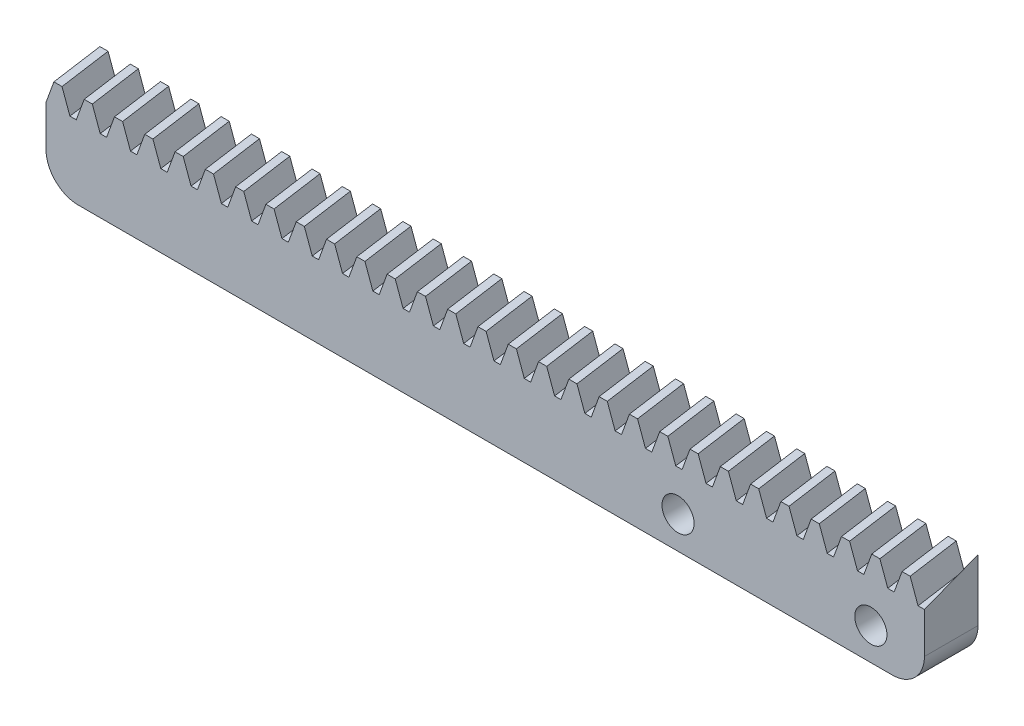
from build123d import *

# Parameters (mm, degrees)
SKETCH1_W           = 81.995568259
SKETCH1_H           = 8
EXTRUDE1_DEPTH      = 5
SKETCH_1_W          = 5
SKETCH_1_H          = 10
CUT_EXTRUDE_1_DEPTH = 85.754897932
SKETCH_2_W          = 81.995568259
SKETCH_2_H          = 5
CUT_EXTRUDE_2_DEPTH = 1.2
SKETCH_3_R          = 1.5
CUT_EXTRUDE_3_DEPTH = 83.428837386
FILLET_1_R          = 3


with BuildPart() as part:
    # Sketch1 → Extrude1 (new body)
    with BuildSketch(Plane.XY):
        with Locations((40.99778413, -4)):
            Rectangle(SKETCH1_W, SKETCH1_H)
    extrude(amount=EXTRUDE1_DEPTH)

    # 扫描1: read off the stored shape, not the designer's step
    # 扫描1: loft between two sections, ruled curve by curve
    sweep_1_from = [
        Edge.make_line((1.495609997, 2.025, 5), (0.792905823, 2.025, 0)),
        Edge.make_line((0.034335551, 2.025, 0), (0.737039724, 2.025, 5)),
        Edge.make_line((0.034335551, 2.025, 0), (0.792905823, 2.025, 0)),
        Edge.make_line((0.737039724, 2.025, 5), (1.495609997, 2.025, 5)),
    ]
    sweep_1_to = [
        Edge.make_line((2.232649721, 0, 5), (1.529945548, 0, 0)),
        Edge.make_line((-0.702704174, 0, 0), (0, 0, 5)),
        Edge.make_line((-0.702704174, 0, 0), (1.529945548, 0, 0)),
        Edge.make_line((0, 0, 5), (2.232649721, 0, 5)),
    ]
    sweep_1 = Solid(Shell([*[Face.make_surface_from_curves(sweep_1_from[k], sweep_1_to[k]) for k in range(4)], Face(Wire(sweep_1_from)), Face(Wire(sweep_1_to))]))
    add(sweep_1)

    # 阵列(线性)1: read off the stored shape, not the designer's step
    # 阵列(线性)1: loft between two sections, ruled curve by curve
    pattern_linear_1_from = [
        Edge.make_line((83.491178256, 2.025, 5), (82.732607983, 2.025, 5)),
        Edge.make_line((83.491178256, 2.025, 5), (82.788474082, 2.025, 0)),
        Edge.make_line((82.02990381, 2.025, 0), (82.732607983, 2.025, 5)),
        Edge.make_line((82.02990381, 2.025, 0), (82.788474082, 2.025, 0)),
    ]
    pattern_linear_1_to = [
        Edge.make_line((84.22821798, 0, 5), (81.995568259, 0, 5)),
        Edge.make_line((84.22821798, 0, 5), (83.525513806, 0, 0)),
        Edge.make_line((81.292864085, 0, 0), (81.995568259, 0, 5)),
        Edge.make_line((81.292864085, 0, 0), (83.525513806, 0, 0)),
    ]
    pattern_linear_1 = Solid(Shell([*[Face.make_surface_from_curves(pattern_linear_1_from[k], pattern_linear_1_to[k]) for k in range(4)], Face(Wire(pattern_linear_1_from)), Face(Wire(pattern_linear_1_to))]))
    add(pattern_linear_1)

    # Pattern Linear 1 2: loft between two sections, ruled curve by curve
    pattern_linear_1_2_from = [
        Edge.make_line((4.323043385, 2.025, 5), (3.620339212, 2.025, 0)),
        Edge.make_line((2.861768939, 2.025, 0), (3.564473113, 2.025, 5)),
        Edge.make_line((3.564473113, 2.025, 5), (4.323043385, 2.025, 5)),
        Edge.make_line((2.861768939, 2.025, 0), (3.620339212, 2.025, 0)),
    ]
    pattern_linear_1_2_to = [
        Edge.make_line((5.060083109, 0, 5), (4.357378936, 0, 0)),
        Edge.make_line((2.124729215, 0, 0), (2.827433388, 0, 5)),
        Edge.make_line((2.827433388, 0, 5), (5.060083109, 0, 5)),
        Edge.make_line((2.124729215, 0, 0), (4.357378936, 0, 0)),
    ]
    pattern_linear_1_2 = Solid(Shell([*[Face.make_surface_from_curves(pattern_linear_1_2_from[k], pattern_linear_1_2_to[k]) for k in range(4)], Face(Wire(pattern_linear_1_2_from)), Face(Wire(pattern_linear_1_2_to))]))
    add(pattern_linear_1_2)

    # Pattern Linear 1 3: loft between two sections, ruled curve by curve
    pattern_linear_1_3_from = [
        Edge.make_line((7.150476773, 2.025, 5), (6.4477726, 2.025, 0)),
        Edge.make_line((5.689202327, 2.025, 0), (6.391906501, 2.025, 5)),
        Edge.make_line((6.391906501, 2.025, 5), (7.150476773, 2.025, 5)),
        Edge.make_line((5.689202327, 2.025, 0), (6.4477726, 2.025, 0)),
    ]
    pattern_linear_1_3_to = [
        Edge.make_line((7.887516498, 0, 5), (7.184812324, 0, 0)),
        Edge.make_line((4.952162603, 0, 0), (5.654866776, 0, 5)),
        Edge.make_line((5.654866776, 0, 5), (7.887516498, 0, 5)),
        Edge.make_line((4.952162603, 0, 0), (7.184812324, 0, 0)),
    ]
    pattern_linear_1_3 = Solid(Shell([*[Face.make_surface_from_curves(pattern_linear_1_3_from[k], pattern_linear_1_3_to[k]) for k in range(4)], Face(Wire(pattern_linear_1_3_from)), Face(Wire(pattern_linear_1_3_to))]))
    add(pattern_linear_1_3)

    # Pattern Linear 1 4: loft between two sections, ruled curve by curve
    pattern_linear_1_4_from = [
        Edge.make_line((9.977910162, 2.025, 5), (9.275205988, 2.025, 0)),
        Edge.make_line((8.516635716, 2.025, 0), (9.219339889, 2.025, 5)),
        Edge.make_line((8.516635716, 2.025, 0), (9.275205988, 2.025, 0)),
        Edge.make_line((9.219339889, 2.025, 5), (9.977910162, 2.025, 5)),
    ]
    pattern_linear_1_4_to = [
        Edge.make_line((10.714949886, 0, 5), (10.012245712, 0, 0)),
        Edge.make_line((7.779595991, 0, 0), (8.482300165, 0, 5)),
        Edge.make_line((7.779595991, 0, 0), (10.012245712, 0, 0)),
        Edge.make_line((8.482300165, 0, 5), (10.714949886, 0, 5)),
    ]
    pattern_linear_1_4 = Solid(Shell([*[Face.make_surface_from_curves(pattern_linear_1_4_from[k], pattern_linear_1_4_to[k]) for k in range(4)], Face(Wire(pattern_linear_1_4_from)), Face(Wire(pattern_linear_1_4_to))]))
    add(pattern_linear_1_4)

    # Pattern Linear 1 5: loft between two sections, ruled curve by curve
    pattern_linear_1_5_from = [
        Edge.make_line((12.80534355, 2.025, 5), (12.102639376, 2.025, 0)),
        Edge.make_line((11.344069104, 2.025, 0), (12.046773277, 2.025, 5)),
        Edge.make_line((11.344069104, 2.025, 0), (12.102639376, 2.025, 0)),
        Edge.make_line((12.046773277, 2.025, 5), (12.80534355, 2.025, 5)),
    ]
    pattern_linear_1_5_to = [
        Edge.make_line((13.542383274, 0, 5), (12.839679101, 0, 0)),
        Edge.make_line((10.607029379, 0, 0), (11.309733553, 0, 5)),
        Edge.make_line((10.607029379, 0, 0), (12.839679101, 0, 0)),
        Edge.make_line((11.309733553, 0, 5), (13.542383274, 0, 5)),
    ]
    pattern_linear_1_5 = Solid(Shell([*[Face.make_surface_from_curves(pattern_linear_1_5_from[k], pattern_linear_1_5_to[k]) for k in range(4)], Face(Wire(pattern_linear_1_5_from)), Face(Wire(pattern_linear_1_5_to))]))
    add(pattern_linear_1_5)

    # Pattern Linear 1 6: loft between two sections, ruled curve by curve
    pattern_linear_1_6_from = [
        Edge.make_line((15.632776938, 2.025, 5), (14.930072764, 2.025, 0)),
        Edge.make_line((14.171502492, 2.025, 0), (14.874206666, 2.025, 5)),
        Edge.make_line((14.171502492, 2.025, 0), (14.930072764, 2.025, 0)),
        Edge.make_line((14.874206666, 2.025, 5), (15.632776938, 2.025, 5)),
    ]
    pattern_linear_1_6_to = [
        Edge.make_line((16.369816662, 0, 5), (15.667112489, 0, 0)),
        Edge.make_line((13.434462768, 0, 0), (14.137166941, 0, 5)),
        Edge.make_line((13.434462768, 0, 0), (15.667112489, 0, 0)),
        Edge.make_line((14.137166941, 0, 5), (16.369816662, 0, 5)),
    ]
    pattern_linear_1_6 = Solid(Shell([*[Face.make_surface_from_curves(pattern_linear_1_6_from[k], pattern_linear_1_6_to[k]) for k in range(4)], Face(Wire(pattern_linear_1_6_from)), Face(Wire(pattern_linear_1_6_to))]))
    add(pattern_linear_1_6)

    # Pattern Linear 1 7: loft between two sections, ruled curve by curve
    pattern_linear_1_7_from = [
        Edge.make_line((18.460210326, 2.025, 5), (17.757506153, 2.025, 0)),
        Edge.make_line((16.99893588, 2.025, 0), (17.701640054, 2.025, 5)),
        Edge.make_line((17.701640054, 2.025, 5), (18.460210326, 2.025, 5)),
        Edge.make_line((16.99893588, 2.025, 0), (17.757506153, 2.025, 0)),
    ]
    pattern_linear_1_7_to = [
        Edge.make_line((19.197250051, 0, 5), (18.494545877, 0, 0)),
        Edge.make_line((16.261896156, 0, 0), (16.964600329, 0, 5)),
        Edge.make_line((16.964600329, 0, 5), (19.197250051, 0, 5)),
        Edge.make_line((16.261896156, 0, 0), (18.494545877, 0, 0)),
    ]
    pattern_linear_1_7 = Solid(Shell([*[Face.make_surface_from_curves(pattern_linear_1_7_from[k], pattern_linear_1_7_to[k]) for k in range(4)], Face(Wire(pattern_linear_1_7_from)), Face(Wire(pattern_linear_1_7_to))]))
    add(pattern_linear_1_7)

    # Pattern Linear 1 8: loft between two sections, ruled curve by curve
    pattern_linear_1_8_from = [
        Edge.make_line((21.287643714, 2.025, 5), (20.584939541, 2.025, 0)),
        Edge.make_line((19.826369268, 2.025, 0), (20.529073442, 2.025, 5)),
        Edge.make_line((20.529073442, 2.025, 5), (21.287643714, 2.025, 5)),
        Edge.make_line((19.826369268, 2.025, 0), (20.584939541, 2.025, 0)),
    ]
    pattern_linear_1_8_to = [
        Edge.make_line((22.024683439, 0, 5), (21.321979265, 0, 0)),
        Edge.make_line((19.089329544, 0, 0), (19.792033718, 0, 5)),
        Edge.make_line((19.792033718, 0, 5), (22.024683439, 0, 5)),
        Edge.make_line((19.089329544, 0, 0), (21.321979265, 0, 0)),
    ]
    pattern_linear_1_8 = Solid(Shell([*[Face.make_surface_from_curves(pattern_linear_1_8_from[k], pattern_linear_1_8_to[k]) for k in range(4)], Face(Wire(pattern_linear_1_8_from)), Face(Wire(pattern_linear_1_8_to))]))
    add(pattern_linear_1_8)

    # Pattern Linear 1 9: loft between two sections, ruled curve by curve
    pattern_linear_1_9_from = [
        Edge.make_line((24.115077103, 2.025, 5), (23.412372929, 2.025, 0)),
        Edge.make_line((22.653802657, 2.025, 0), (23.35650683, 2.025, 5)),
        Edge.make_line((22.653802657, 2.025, 0), (23.412372929, 2.025, 0)),
        Edge.make_line((23.35650683, 2.025, 5), (24.115077103, 2.025, 5)),
    ]
    pattern_linear_1_9_to = [
        Edge.make_line((24.852116827, 0, 5), (24.149412654, 0, 0)),
        Edge.make_line((21.916762932, 0, 0), (22.619467106, 0, 5)),
        Edge.make_line((21.916762932, 0, 0), (24.149412654, 0, 0)),
        Edge.make_line((22.619467106, 0, 5), (24.852116827, 0, 5)),
    ]
    pattern_linear_1_9 = Solid(Shell([*[Face.make_surface_from_curves(pattern_linear_1_9_from[k], pattern_linear_1_9_to[k]) for k in range(4)], Face(Wire(pattern_linear_1_9_from)), Face(Wire(pattern_linear_1_9_to))]))
    add(pattern_linear_1_9)

    # Pattern Linear 1 10: loft between two sections, ruled curve by curve
    pattern_linear_1_10_from = [
        Edge.make_line((26.942510491, 2.025, 5), (26.239806317, 2.025, 0)),
        Edge.make_line((25.481236045, 2.025, 0), (26.183940218, 2.025, 5)),
        Edge.make_line((25.481236045, 2.025, 0), (26.239806317, 2.025, 0)),
        Edge.make_line((26.183940218, 2.025, 5), (26.942510491, 2.025, 5)),
    ]
    pattern_linear_1_10_to = [
        Edge.make_line((27.679550215, 0, 5), (26.976846042, 0, 0)),
        Edge.make_line((24.744196321, 0, 0), (25.446900494, 0, 5)),
        Edge.make_line((24.744196321, 0, 0), (26.976846042, 0, 0)),
        Edge.make_line((25.446900494, 0, 5), (27.679550215, 0, 5)),
    ]
    pattern_linear_1_10 = Solid(Shell([*[Face.make_surface_from_curves(pattern_linear_1_10_from[k], pattern_linear_1_10_to[k]) for k in range(4)], Face(Wire(pattern_linear_1_10_from)), Face(Wire(pattern_linear_1_10_to))]))
    add(pattern_linear_1_10)

    # Pattern Linear 1 11: loft between two sections, ruled curve by curve
    pattern_linear_1_11_from = [
        Edge.make_line((29.769943879, 2.025, 5), (29.067239706, 2.025, 0)),
        Edge.make_line((28.308669433, 2.025, 0), (29.011373607, 2.025, 5)),
        Edge.make_line((29.011373607, 2.025, 5), (29.769943879, 2.025, 5)),
        Edge.make_line((28.308669433, 2.025, 0), (29.067239706, 2.025, 0)),
    ]
    pattern_linear_1_11_to = [
        Edge.make_line((30.506983604, 0, 5), (29.80427943, 0, 0)),
        Edge.make_line((27.571629709, 0, 0), (28.274333882, 0, 5)),
        Edge.make_line((28.274333882, 0, 5), (30.506983604, 0, 5)),
        Edge.make_line((27.571629709, 0, 0), (29.80427943, 0, 0)),
    ]
    pattern_linear_1_11 = Solid(Shell([*[Face.make_surface_from_curves(pattern_linear_1_11_from[k], pattern_linear_1_11_to[k]) for k in range(4)], Face(Wire(pattern_linear_1_11_from)), Face(Wire(pattern_linear_1_11_to))]))
    add(pattern_linear_1_11)

    # Pattern Linear 1 12: loft between two sections, ruled curve by curve
    pattern_linear_1_12_from = [
        Edge.make_line((32.597377267, 2.025, 5), (31.894673094, 2.025, 0)),
        Edge.make_line((31.136102821, 2.025, 0), (31.838806995, 2.025, 5)),
        Edge.make_line((31.838806995, 2.025, 5), (32.597377267, 2.025, 5)),
        Edge.make_line((31.136102821, 2.025, 0), (31.894673094, 2.025, 0)),
    ]
    pattern_linear_1_12_to = [
        Edge.make_line((33.334416992, 0, 5), (32.631712818, 0, 0)),
        Edge.make_line((30.399063097, 0, 0), (31.101767271, 0, 5)),
        Edge.make_line((31.101767271, 0, 5), (33.334416992, 0, 5)),
        Edge.make_line((30.399063097, 0, 0), (32.631712818, 0, 0)),
    ]
    pattern_linear_1_12 = Solid(Shell([*[Face.make_surface_from_curves(pattern_linear_1_12_from[k], pattern_linear_1_12_to[k]) for k in range(4)], Face(Wire(pattern_linear_1_12_from)), Face(Wire(pattern_linear_1_12_to))]))
    add(pattern_linear_1_12)

    # Pattern Linear 1 13: loft between two sections, ruled curve by curve
    pattern_linear_1_13_from = [
        Edge.make_line((35.424810656, 2.025, 5), (34.722106482, 2.025, 0)),
        Edge.make_line((33.96353621, 2.025, 0), (34.666240383, 2.025, 5)),
        Edge.make_line((33.96353621, 2.025, 0), (34.722106482, 2.025, 0)),
        Edge.make_line((34.666240383, 2.025, 5), (35.424810656, 2.025, 5)),
    ]
    pattern_linear_1_13_to = [
        Edge.make_line((36.16185038, 0, 5), (35.459146206, 0, 0)),
        Edge.make_line((33.226496485, 0, 0), (33.929200659, 0, 5)),
        Edge.make_line((33.226496485, 0, 0), (35.459146206, 0, 0)),
        Edge.make_line((33.929200659, 0, 5), (36.16185038, 0, 5)),
    ]
    pattern_linear_1_13 = Solid(Shell([*[Face.make_surface_from_curves(pattern_linear_1_13_from[k], pattern_linear_1_13_to[k]) for k in range(4)], Face(Wire(pattern_linear_1_13_from)), Face(Wire(pattern_linear_1_13_to))]))
    add(pattern_linear_1_13)

    # Pattern Linear 1 14: loft between two sections, ruled curve by curve
    pattern_linear_1_14_from = [
        Edge.make_line((38.252244044, 2.025, 5), (37.54953987, 2.025, 0)),
        Edge.make_line((36.790969598, 2.025, 0), (37.493673771, 2.025, 5)),
        Edge.make_line((36.790969598, 2.025, 0), (37.54953987, 2.025, 0)),
        Edge.make_line((37.493673771, 2.025, 5), (38.252244044, 2.025, 5)),
    ]
    pattern_linear_1_14_to = [
        Edge.make_line((38.989283768, 0, 5), (38.286579595, 0, 0)),
        Edge.make_line((36.053929873, 0, 0), (36.756634047, 0, 5)),
        Edge.make_line((36.053929873, 0, 0), (38.286579595, 0, 0)),
        Edge.make_line((36.756634047, 0, 5), (38.989283768, 0, 5)),
    ]
    pattern_linear_1_14 = Solid(Shell([*[Face.make_surface_from_curves(pattern_linear_1_14_from[k], pattern_linear_1_14_to[k]) for k in range(4)], Face(Wire(pattern_linear_1_14_from)), Face(Wire(pattern_linear_1_14_to))]))
    add(pattern_linear_1_14)

    # Pattern Linear 1 15: loft between two sections, ruled curve by curve
    pattern_linear_1_15_from = [
        Edge.make_line((41.079677432, 2.025, 5), (40.376973259, 2.025, 0)),
        Edge.make_line((39.618402986, 2.025, 0), (40.32110716, 2.025, 5)),
        Edge.make_line((40.32110716, 2.025, 5), (41.079677432, 2.025, 5)),
        Edge.make_line((39.618402986, 2.025, 0), (40.376973259, 2.025, 0)),
    ]
    pattern_linear_1_15_to = [
        Edge.make_line((41.816717156, 0, 5), (41.114012983, 0, 0)),
        Edge.make_line((38.881363262, 0, 0), (39.584067435, 0, 5)),
        Edge.make_line((39.584067435, 0, 5), (41.816717156, 0, 5)),
        Edge.make_line((38.881363262, 0, 0), (41.114012983, 0, 0)),
    ]
    pattern_linear_1_15 = Solid(Shell([*[Face.make_surface_from_curves(pattern_linear_1_15_from[k], pattern_linear_1_15_to[k]) for k in range(4)], Face(Wire(pattern_linear_1_15_from)), Face(Wire(pattern_linear_1_15_to))]))
    add(pattern_linear_1_15)

    # Pattern Linear 1 16: loft between two sections, ruled curve by curve
    pattern_linear_1_16_from = [
        Edge.make_line((43.90711082, 2.025, 5), (43.204406647, 2.025, 0)),
        Edge.make_line((42.445836374, 2.025, 0), (43.148540548, 2.025, 5)),
        Edge.make_line((43.148540548, 2.025, 5), (43.90711082, 2.025, 5)),
        Edge.make_line((42.445836374, 2.025, 0), (43.204406647, 2.025, 0)),
    ]
    pattern_linear_1_16_to = [
        Edge.make_line((44.644150545, 0, 5), (43.941446371, 0, 0)),
        Edge.make_line((41.70879665, 0, 0), (42.411500823, 0, 5)),
        Edge.make_line((42.411500823, 0, 5), (44.644150545, 0, 5)),
        Edge.make_line((41.70879665, 0, 0), (43.941446371, 0, 0)),
    ]
    pattern_linear_1_16 = Solid(Shell([*[Face.make_surface_from_curves(pattern_linear_1_16_from[k], pattern_linear_1_16_to[k]) for k in range(4)], Face(Wire(pattern_linear_1_16_from)), Face(Wire(pattern_linear_1_16_to))]))
    add(pattern_linear_1_16)

    # Pattern Linear 1 17: loft between two sections, ruled curve by curve
    pattern_linear_1_17_from = [
        Edge.make_line((46.734544209, 2.025, 5), (46.031840035, 2.025, 0)),
        Edge.make_line((45.273269763, 2.025, 0), (45.975973936, 2.025, 5)),
        Edge.make_line((45.273269763, 2.025, 0), (46.031840035, 2.025, 0)),
        Edge.make_line((45.975973936, 2.025, 5), (46.734544209, 2.025, 5)),
    ]
    pattern_linear_1_17_to = [
        Edge.make_line((47.471583933, 0, 5), (46.768879759, 0, 0)),
        Edge.make_line((44.536230038, 0, 0), (45.238934212, 0, 5)),
        Edge.make_line((44.536230038, 0, 0), (46.768879759, 0, 0)),
        Edge.make_line((45.238934212, 0, 5), (47.471583933, 0, 5)),
    ]
    pattern_linear_1_17 = Solid(Shell([*[Face.make_surface_from_curves(pattern_linear_1_17_from[k], pattern_linear_1_17_to[k]) for k in range(4)], Face(Wire(pattern_linear_1_17_from)), Face(Wire(pattern_linear_1_17_to))]))
    add(pattern_linear_1_17)

    # Pattern Linear 1 18: loft between two sections, ruled curve by curve
    pattern_linear_1_18_from = [
        Edge.make_line((49.561977597, 2.025, 5), (48.859273423, 2.025, 0)),
        Edge.make_line((48.100703151, 2.025, 0), (48.803407324, 2.025, 5)),
        Edge.make_line((48.100703151, 2.025, 0), (48.859273423, 2.025, 0)),
        Edge.make_line((48.803407324, 2.025, 5), (49.561977597, 2.025, 5)),
    ]
    pattern_linear_1_18_to = [
        Edge.make_line((50.299017321, 0, 5), (49.596313148, 0, 0)),
        Edge.make_line((47.363663426, 0, 0), (48.0663676, 0, 5)),
        Edge.make_line((47.363663426, 0, 0), (49.596313148, 0, 0)),
        Edge.make_line((48.0663676, 0, 5), (50.299017321, 0, 5)),
    ]
    pattern_linear_1_18 = Solid(Shell([*[Face.make_surface_from_curves(pattern_linear_1_18_from[k], pattern_linear_1_18_to[k]) for k in range(4)], Face(Wire(pattern_linear_1_18_from)), Face(Wire(pattern_linear_1_18_to))]))
    add(pattern_linear_1_18)

    # Pattern Linear 1 19: loft between two sections, ruled curve by curve
    pattern_linear_1_19_from = [
        Edge.make_line((52.389410985, 2.025, 5), (51.686706811, 2.025, 0)),
        Edge.make_line((50.928136539, 2.025, 0), (51.630840713, 2.025, 5)),
        Edge.make_line((50.928136539, 2.025, 0), (51.686706811, 2.025, 0)),
        Edge.make_line((51.630840713, 2.025, 5), (52.389410985, 2.025, 5)),
    ]
    pattern_linear_1_19_to = [
        Edge.make_line((53.126450709, 0, 5), (52.423746536, 0, 0)),
        Edge.make_line((50.191096815, 0, 0), (50.893800988, 0, 5)),
        Edge.make_line((50.191096815, 0, 0), (52.423746536, 0, 0)),
        Edge.make_line((50.893800988, 0, 5), (53.126450709, 0, 5)),
    ]
    pattern_linear_1_19 = Solid(Shell([*[Face.make_surface_from_curves(pattern_linear_1_19_from[k], pattern_linear_1_19_to[k]) for k in range(4)], Face(Wire(pattern_linear_1_19_from)), Face(Wire(pattern_linear_1_19_to))]))
    add(pattern_linear_1_19)

    # Pattern Linear 1 20: loft between two sections, ruled curve by curve
    pattern_linear_1_20_from = [
        Edge.make_line((55.216844373, 2.025, 5), (54.5141402, 2.025, 0)),
        Edge.make_line((53.755569927, 2.025, 0), (54.458274101, 2.025, 5)),
        Edge.make_line((54.458274101, 2.025, 5), (55.216844373, 2.025, 5)),
        Edge.make_line((53.755569927, 2.025, 0), (54.5141402, 2.025, 0)),
    ]
    pattern_linear_1_20_to = [
        Edge.make_line((55.953884098, 0, 5), (55.251179924, 0, 0)),
        Edge.make_line((53.018530203, 0, 0), (53.721234376, 0, 5)),
        Edge.make_line((53.721234376, 0, 5), (55.953884098, 0, 5)),
        Edge.make_line((53.018530203, 0, 0), (55.251179924, 0, 0)),
    ]
    pattern_linear_1_20 = Solid(Shell([*[Face.make_surface_from_curves(pattern_linear_1_20_from[k], pattern_linear_1_20_to[k]) for k in range(4)], Face(Wire(pattern_linear_1_20_from)), Face(Wire(pattern_linear_1_20_to))]))
    add(pattern_linear_1_20)

    # Pattern Linear 1 21: loft between two sections, ruled curve by curve
    pattern_linear_1_21_from = [
        Edge.make_line((58.044277761, 2.025, 5), (57.341573588, 2.025, 0)),
        Edge.make_line((56.583003315, 2.025, 0), (57.285707489, 2.025, 5)),
        Edge.make_line((57.285707489, 2.025, 5), (58.044277761, 2.025, 5)),
        Edge.make_line((56.583003315, 2.025, 0), (57.341573588, 2.025, 0)),
    ]
    pattern_linear_1_21_to = [
        Edge.make_line((58.781317486, 0, 5), (58.078613312, 0, 0)),
        Edge.make_line((55.845963591, 0, 0), (56.548667765, 0, 5)),
        Edge.make_line((56.548667765, 0, 5), (58.781317486, 0, 5)),
        Edge.make_line((55.845963591, 0, 0), (58.078613312, 0, 0)),
    ]
    pattern_linear_1_21 = Solid(Shell([*[Face.make_surface_from_curves(pattern_linear_1_21_from[k], pattern_linear_1_21_to[k]) for k in range(4)], Face(Wire(pattern_linear_1_21_from)), Face(Wire(pattern_linear_1_21_to))]))
    add(pattern_linear_1_21)

    # Pattern Linear 1 22: loft between two sections, ruled curve by curve
    pattern_linear_1_22_from = [
        Edge.make_line((60.87171115, 2.025, 5), (60.169006976, 2.025, 0)),
        Edge.make_line((59.410436704, 2.025, 0), (60.113140877, 2.025, 5)),
        Edge.make_line((59.410436704, 2.025, 0), (60.169006976, 2.025, 0)),
        Edge.make_line((60.113140877, 2.025, 5), (60.87171115, 2.025, 5)),
    ]
    pattern_linear_1_22_to = [
        Edge.make_line((61.608750874, 0, 5), (60.906046701, 0, 0)),
        Edge.make_line((58.673396979, 0, 0), (59.376101153, 0, 5)),
        Edge.make_line((58.673396979, 0, 0), (60.906046701, 0, 0)),
        Edge.make_line((59.376101153, 0, 5), (61.608750874, 0, 5)),
    ]
    pattern_linear_1_22 = Solid(Shell([*[Face.make_surface_from_curves(pattern_linear_1_22_from[k], pattern_linear_1_22_to[k]) for k in range(4)], Face(Wire(pattern_linear_1_22_from)), Face(Wire(pattern_linear_1_22_to))]))
    add(pattern_linear_1_22)

    # Pattern Linear 1 23: loft between two sections, ruled curve by curve
    pattern_linear_1_23_from = [
        Edge.make_line((63.699144538, 2.025, 5), (62.996440364, 2.025, 0)),
        Edge.make_line((62.237870092, 2.025, 0), (62.940574265, 2.025, 5)),
        Edge.make_line((62.237870092, 2.025, 0), (62.996440364, 2.025, 0)),
        Edge.make_line((62.940574265, 2.025, 5), (63.699144538, 2.025, 5)),
    ]
    pattern_linear_1_23_to = [
        Edge.make_line((64.436184262, 0, 5), (63.733480089, 0, 0)),
        Edge.make_line((61.500830368, 0, 0), (62.203534541, 0, 5)),
        Edge.make_line((61.500830368, 0, 0), (63.733480089, 0, 0)),
        Edge.make_line((62.203534541, 0, 5), (64.436184262, 0, 5)),
    ]
    pattern_linear_1_23 = Solid(Shell([*[Face.make_surface_from_curves(pattern_linear_1_23_from[k], pattern_linear_1_23_to[k]) for k in range(4)], Face(Wire(pattern_linear_1_23_from)), Face(Wire(pattern_linear_1_23_to))]))
    add(pattern_linear_1_23)

    # Pattern Linear 1 24: loft between two sections, ruled curve by curve
    pattern_linear_1_24_from = [
        Edge.make_line((66.526577926, 2.025, 5), (65.823873753, 2.025, 0)),
        Edge.make_line((65.06530348, 2.025, 0), (65.768007654, 2.025, 5)),
        Edge.make_line((65.768007654, 2.025, 5), (66.526577926, 2.025, 5)),
        Edge.make_line((65.06530348, 2.025, 0), (65.823873753, 2.025, 0)),
    ]
    pattern_linear_1_24_to = [
        Edge.make_line((67.263617651, 0, 5), (66.560913477, 0, 0)),
        Edge.make_line((64.328263756, 0, 0), (65.030967929, 0, 5)),
        Edge.make_line((65.030967929, 0, 5), (67.263617651, 0, 5)),
        Edge.make_line((64.328263756, 0, 0), (66.560913477, 0, 0)),
    ]
    pattern_linear_1_24 = Solid(Shell([*[Face.make_surface_from_curves(pattern_linear_1_24_from[k], pattern_linear_1_24_to[k]) for k in range(4)], Face(Wire(pattern_linear_1_24_from)), Face(Wire(pattern_linear_1_24_to))]))
    add(pattern_linear_1_24)

    # Pattern Linear 1 25: loft between two sections, ruled curve by curve
    pattern_linear_1_25_from = [
        Edge.make_line((69.354011314, 2.025, 5), (68.651307141, 2.025, 0)),
        Edge.make_line((67.892736868, 2.025, 0), (68.595441042, 2.025, 5)),
        Edge.make_line((68.595441042, 2.025, 5), (69.354011314, 2.025, 5)),
        Edge.make_line((67.892736868, 2.025, 0), (68.651307141, 2.025, 0)),
    ]
    pattern_linear_1_25_to = [
        Edge.make_line((70.091051039, 0, 5), (69.388346865, 0, 0)),
        Edge.make_line((67.155697144, 0, 0), (67.858401318, 0, 5)),
        Edge.make_line((67.858401318, 0, 5), (70.091051039, 0, 5)),
        Edge.make_line((67.155697144, 0, 0), (69.388346865, 0, 0)),
    ]
    pattern_linear_1_25 = Solid(Shell([*[Face.make_surface_from_curves(pattern_linear_1_25_from[k], pattern_linear_1_25_to[k]) for k in range(4)], Face(Wire(pattern_linear_1_25_from)), Face(Wire(pattern_linear_1_25_to))]))
    add(pattern_linear_1_25)

    # Pattern Linear 1 26: loft between two sections, ruled curve by curve
    pattern_linear_1_26_from = [
        Edge.make_line((72.181444703, 2.025, 5), (71.478740529, 2.025, 0)),
        Edge.make_line((70.720170257, 2.025, 0), (71.42287443, 2.025, 5)),
        Edge.make_line((70.720170257, 2.025, 0), (71.478740529, 2.025, 0)),
        Edge.make_line((71.42287443, 2.025, 5), (72.181444703, 2.025, 5)),
    ]
    pattern_linear_1_26_to = [
        Edge.make_line((72.918484427, 0, 5), (72.215780253, 0, 0)),
        Edge.make_line((69.983130532, 0, 0), (70.685834706, 0, 5)),
        Edge.make_line((69.983130532, 0, 0), (72.215780253, 0, 0)),
        Edge.make_line((70.685834706, 0, 5), (72.918484427, 0, 5)),
    ]
    pattern_linear_1_26 = Solid(Shell([*[Face.make_surface_from_curves(pattern_linear_1_26_from[k], pattern_linear_1_26_to[k]) for k in range(4)], Face(Wire(pattern_linear_1_26_from)), Face(Wire(pattern_linear_1_26_to))]))
    add(pattern_linear_1_26)

    # Pattern Linear 1 27: loft between two sections, ruled curve by curve
    pattern_linear_1_27_from = [
        Edge.make_line((75.008878091, 2.025, 5), (74.306173917, 2.025, 0)),
        Edge.make_line((73.547603645, 2.025, 0), (74.250307818, 2.025, 5)),
        Edge.make_line((73.547603645, 2.025, 0), (74.306173917, 2.025, 0)),
        Edge.make_line((74.250307818, 2.025, 5), (75.008878091, 2.025, 5)),
    ]
    pattern_linear_1_27_to = [
        Edge.make_line((75.745917815, 0, 5), (75.043213642, 0, 0)),
        Edge.make_line((72.81056392, 0, 0), (73.513268094, 0, 5)),
        Edge.make_line((72.81056392, 0, 0), (75.043213642, 0, 0)),
        Edge.make_line((73.513268094, 0, 5), (75.745917815, 0, 5)),
    ]
    pattern_linear_1_27 = Solid(Shell([*[Face.make_surface_from_curves(pattern_linear_1_27_from[k], pattern_linear_1_27_to[k]) for k in range(4)], Face(Wire(pattern_linear_1_27_from)), Face(Wire(pattern_linear_1_27_to))]))
    add(pattern_linear_1_27)

    # Pattern Linear 1 28: loft between two sections, ruled curve by curve
    pattern_linear_1_28_from = [
        Edge.make_line((77.836311479, 2.025, 5), (77.133607306, 2.025, 0)),
        Edge.make_line((76.375037033, 2.025, 0), (77.077741207, 2.025, 5)),
        Edge.make_line((77.077741207, 2.025, 5), (77.836311479, 2.025, 5)),
        Edge.make_line((76.375037033, 2.025, 0), (77.133607306, 2.025, 0)),
    ]
    pattern_linear_1_28_to = [
        Edge.make_line((78.573351203, 0, 5), (77.87064703, 0, 0)),
        Edge.make_line((75.637997309, 0, 0), (76.340701482, 0, 5)),
        Edge.make_line((76.340701482, 0, 5), (78.573351203, 0, 5)),
        Edge.make_line((75.637997309, 0, 0), (77.87064703, 0, 0)),
    ]
    pattern_linear_1_28 = Solid(Shell([*[Face.make_surface_from_curves(pattern_linear_1_28_from[k], pattern_linear_1_28_to[k]) for k in range(4)], Face(Wire(pattern_linear_1_28_from)), Face(Wire(pattern_linear_1_28_to))]))
    add(pattern_linear_1_28)

    # Pattern Linear 1 29: loft between two sections, ruled curve by curve
    pattern_linear_1_29_from = [
        Edge.make_line((80.663744867, 2.025, 5), (79.961040694, 2.025, 0)),
        Edge.make_line((79.202470421, 2.025, 0), (79.905174595, 2.025, 5)),
        Edge.make_line((79.905174595, 2.025, 5), (80.663744867, 2.025, 5)),
        Edge.make_line((79.202470421, 2.025, 0), (79.961040694, 2.025, 0)),
    ]
    pattern_linear_1_29_to = [
        Edge.make_line((81.400784592, 0, 5), (80.698080418, 0, 0)),
        Edge.make_line((78.465430697, 0, 0), (79.16813487, 0, 5)),
        Edge.make_line((79.16813487, 0, 5), (81.400784592, 0, 5)),
        Edge.make_line((78.465430697, 0, 0), (80.698080418, 0, 0)),
    ]
    pattern_linear_1_29 = Solid(Shell([*[Face.make_surface_from_curves(pattern_linear_1_29_from[k], pattern_linear_1_29_to[k]) for k in range(4)], Face(Wire(pattern_linear_1_29_from)), Face(Wire(pattern_linear_1_29_to))]))
    add(pattern_linear_1_29)

    # 草图1 → 切除-拉伸1 (cut, through all)
    with BuildSketch(Plane.XY):
        with Locations((-2.5, 0)):
            Rectangle(SKETCH_1_W, SKETCH_1_H)
        with Locations((84.495568259, 0)):
            Rectangle(SKETCH_1_W, SKETCH_1_H)
    extrude(amount=CUT_EXTRUDE_1_DEPTH, mode=Mode.SUBTRACT)

    # 草图2 → 切除-拉伸2 (cut)
    with BuildSketch(Plane.XZ.offset(8)):
        with Locations((40.99778413, 2.5)):
            Rectangle(SKETCH_2_W, SKETCH_2_H)
    extrude(amount=-CUT_EXTRUDE_2_DEPTH, mode=Mode.SUBTRACT)

    # 草图3 → 切除-拉伸3 (cut, through all)
    with BuildSketch(Plane(origin=(0, 0, 0), x_dir=(-1, 0, 0), z_dir=(0, 0, -1))):
        with Locations((-58.995568259, -3.8)):
            Circle(SKETCH_3_R)
        with Locations((-76.995568259, -3.8)):
            Circle(SKETCH_3_R)
    extrude(amount=-CUT_EXTRUDE_3_DEPTH, mode=Mode.SUBTRACT)

    # 圆角1
    fillet_1_edges = [part.edges().sort_by_distance(p)[0] for p in [
        (0, -6.8, 2.5),
        (81.995568259, -6.8, 2.5),
    ]]
    fillet(fillet_1_edges, radius=FILLET_1_R)


solid = part.part
